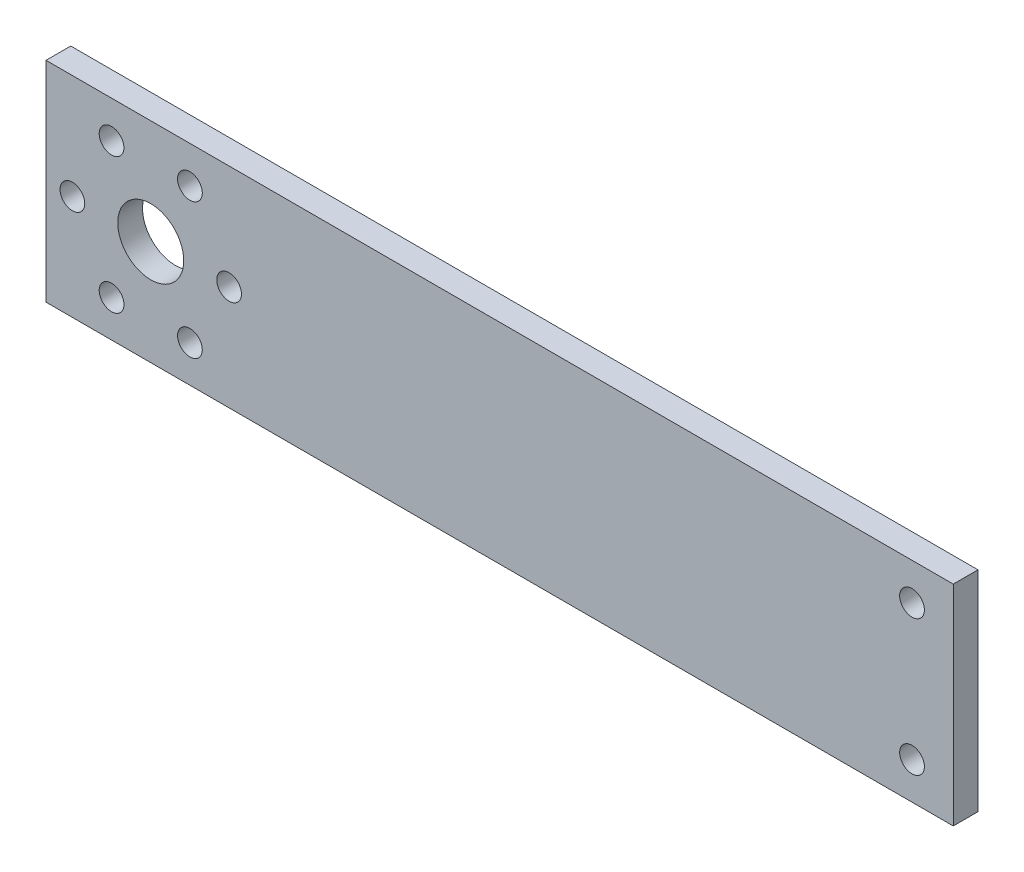
from build123d import *

# Parameters (mm, degrees)
SKETCH1_W           = 110
SKETCH1_H           = 25.4
SKETCH1_R           = 1.5
SKETCH1_R_2         = 4
BOSS_EXTRUDE1_DEPTH = 3


with BuildPart() as part:
    # Sketch1 → Boss-Extrude1 (new body)
    with BuildSketch(Plane.XY):
        with Locations((55, -12.7)):
            Rectangle(SKETCH1_W, SKETCH1_H)
        with Locations((3.2, -12.7)):
            Circle(SKETCH1_R, mode=Mode.SUBTRACT)
        with Locations((7.95, -4.472758664)):
            Circle(SKETCH1_R, mode=Mode.SUBTRACT)
        with Locations((17.45, -4.472758664)):
            Circle(SKETCH1_R, mode=Mode.SUBTRACT)
        with Locations((22.2, -12.7)):
            Circle(SKETCH1_R, mode=Mode.SUBTRACT)
        with Locations((17.45, -20.927241336)):
            Circle(SKETCH1_R, mode=Mode.SUBTRACT)
        with Locations((7.95, -20.927241336)):
            Circle(SKETCH1_R, mode=Mode.SUBTRACT)
        with Locations((12.7, -12.7)):
            Circle(SKETCH1_R_2, mode=Mode.SUBTRACT)
        with Locations(Location((105, -4.472758664, 0), (0, 0, 180))):
            Circle(SKETCH1_R, mode=Mode.SUBTRACT)
        with Locations((105, -20.927241336)):
            Circle(SKETCH1_R, mode=Mode.SUBTRACT)
    extrude(amount=BOSS_EXTRUDE1_DEPTH)


solid = part.part
